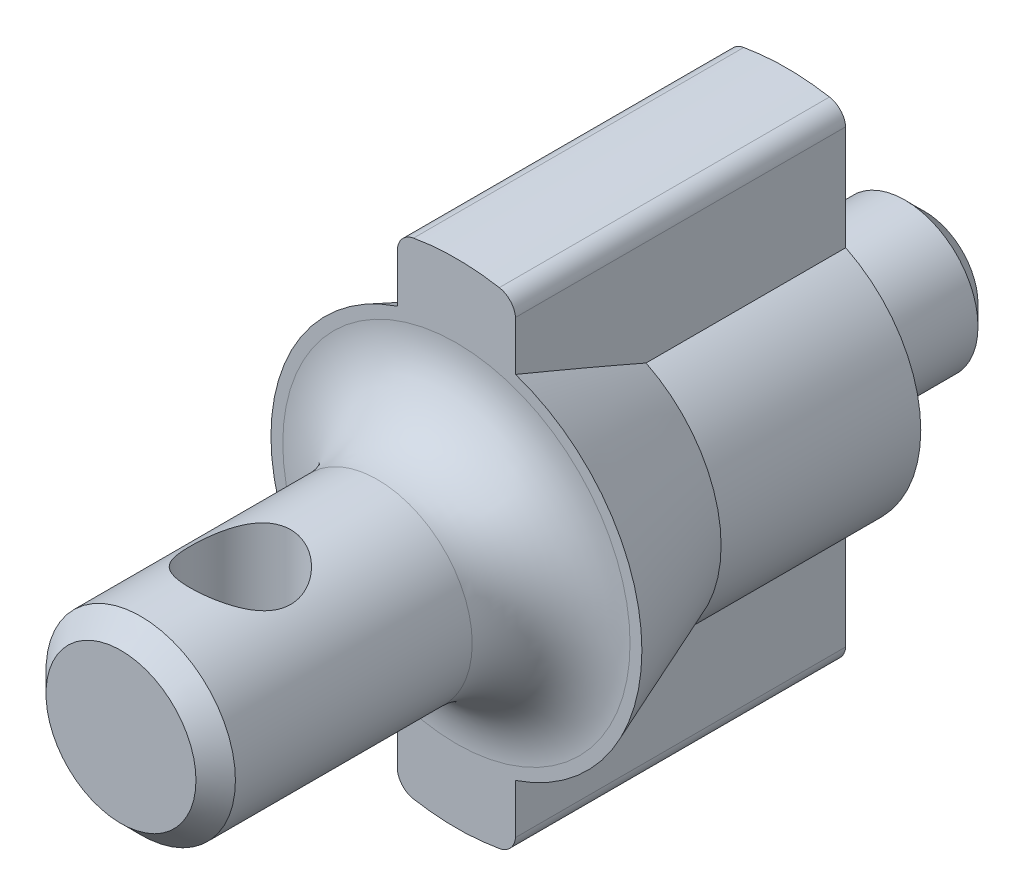
from build123d import *

# Parameters (mm, degrees)
SKETCH1_R               = 4.7
BOSS_EXTRUDE1_DEPTH     = 11.866666667
SKETCH2_OUTSIDE_W       = 14.964
SKETCH2_OUTSIDE_H       = 14.964
SKETCH2_OUTSIDE_R       = 1.85
CUT_EXTRUDE1_DEPTH      = 3.5
BOSS_EXTRUDE2_START     = -8.366666667
BOSS_EXTRUDE2_DEPTH     = 8.366666667
FILLET1_R               = 0.5
FILLET2_R               = 0.5
SKETCH4_R               = 2.4
BOSS_EXTRUDE3_DEPTH     = 8.5
FILLET3_R               = 2
CHAMFER1_SIZE           = 0.5
CUT_EXTRUDE2_DEPTH      = 22.816361088
CUT_EXTRUDE2_DEPTH_BACK = 22.816361088
SKETCH5_R               = 1.275
BOSS_EXTRUDE4_START     = 3.5
BOSS_EXTRUDE4_DEPTH     = 8.366666667


# Read off the part's stored shape, not the designer's step: Boss-Extrude4
with BuildPart() as part:
    # Sketch1 → Boss-Extrude1 (new body)
    with BuildSketch(Plane.XY):
        Circle(SKETCH1_R)
    extrude(amount=BOSS_EXTRUDE1_DEPTH)

    # Sketch2 outside → Cut-Extrude1 (cut)
    with BuildSketch(Plane(origin=(0, 0, 0), x_dir=(-1, 0, 0), z_dir=(0, 0, -1))):
        Rectangle(SKETCH2_OUTSIDE_W, SKETCH2_OUTSIDE_H)
        Circle(SKETCH2_OUTSIDE_R, mode=Mode.SUBTRACT)
    extrude(amount=-CUT_EXTRUDE1_DEPTH, mode=Mode.SUBTRACT)

    # Sketch3 → Boss-Extrude2 (add)
    with BuildSketch(Plane.XY.offset(11.866666667).offset(BOSS_EXTRUDE2_START)):
        with BuildLine():
            Line((-1.5, 6.06733055), (-1.5, 4.45421149))
            ThreePointArc((-1.5, 4.45421149), (0, 4.7), (1.5, 4.45421149))
            Line((1.5, 4.45421149), (1.5, 6.06733055))
            ThreePointArc((1.5, 6.06733055), (0, 6.25), (-1.5, 6.06733055))
        make_face()
        with BuildLine():
            ThreePointArc((1.5, -4.45421149), (0, -4.7), (-1.5, -4.45421149))
            Line((-1.5, -4.45421149), (-1.5, -6.06733055))
            ThreePointArc((-1.5, -6.06733055), (0, -6.25), (1.5, -6.06733055))
            Line((1.5, -6.06733055), (1.5, -4.45421149))
        make_face()
    extrude(amount=BOSS_EXTRUDE2_DEPTH)

    # Fillet1
    fillet1_edges = [part.edges().sort_by_distance(p)[0] for p in [
        (-1.5, 6.06733055, 7.683333333),
        (-1.5, 4.45421149, 7.683333333),
        (1.5, 4.45421149, 7.683333333),
        (1.5, 6.06733055, 7.683333333),
        (1.5, -6.06733055, 7.683333333),
        (1.5, -4.45421149, 7.683333333),
        (-1.5, -4.45421149, 7.683333333),
        (-1.5, -6.06733055, 7.683333333),
    ]]
    fillet(fillet1_edges, radius=FILLET1_R)

    # Fillet2
    fillet2_edges = [part.edges().sort_by_distance(p)[0] for p in [
        (1.85, 0, 3.5),
    ]]
    fillet(fillet2_edges, radius=FILLET2_R)

    # Sketch4 → Boss-Extrude3 (add)
    with BuildSketch(Plane.XY.offset(11.866666667)):
        Circle(SKETCH4_R)
    extrude(amount=BOSS_EXTRUDE3_DEPTH)

    # Fillet3
    fillet3_edges = [part.edges().sort_by_distance(p)[0] for p in [
        (-2.4, 0, 11.866666667),
    ]]
    fillet(fillet3_edges, radius=FILLET3_R)

    # Chamfer1
    chamfer1_edges = [part.edges().sort_by_distance(p)[0] for p in [
        (-2.4, 0, 20.366666667),
        (1.85, 0, 0),
    ]]
    chamfer(chamfer1_edges, length=CHAMFER1_SIZE)

    # Sketch5 → Cut-Extrude2 (cut, two sides: drawn at the far end of the back side and taken through both)
    with BuildSketch(Plane(origin=(0, 0, 0), x_dir=(1, 0, 0), z_dir=(0, 1, 0)).offset(-CUT_EXTRUDE2_DEPTH_BACK)):
        with Locations(Location((0, -17.341666667, 0), (0, 0, 270))):
            Circle(SKETCH5_R)
    extrude(amount=CUT_EXTRUDE2_DEPTH + CUT_EXTRUDE2_DEPTH_BACK, mode=Mode.SUBTRACT)

    # Sketch6 → Cut-Revolve1 (revolve, cut)
    with BuildSketch(Plane(origin=(0, 0, 0), x_dir=(1, 0, 0), z_dir=(0, 1, 0)), mode=Mode.PRIVATE) as cut_revolve1_sk:
        Polygon((-4.7, -3.5), (-5.9, -3.5), (-5.9, -11.866666667), (-4.7, -11.866666667), (-3.4, -8.55965578), (-3.4, -3.5), align=None)
    revolve(cut_revolve1_sk.sketch.rotate(Axis((0, 0, 0), (0, 0, 1)), 180), axis=Axis((0, 0, 0), (0, 0, 1)), mode=Mode.SUBTRACT)


with BuildPart() as cut_revolve1_piece_1:
    # of the separate pieces the step leaves, piece 1, a body of its own (cut_revolve1_pieces)
    add(part.part.solids().sort_by_distance((2.4, 0, 19.866666667))[0])



with BuildPart() as cut_revolve1_piece_2:
    # of the separate pieces the step leaves, piece 2, a body of its own (cut_revolve1_pieces)
    add(part.part.solids().sort_by_distance((1.498035668, 5.706653059, 11.866666667))[0])


with BuildPart() as cut_revolve1_piece_3:
    # of the separate pieces the step leaves, piece 3, a body of its own (cut_revolve1_pieces)
    add(part.part.solids().sort_by_distance((1.498035668, -5.706653059, 11.866666667))[0])


with BuildPart() as cut_revolve1_piece_1_1:
    add(cut_revolve1_piece_1.part)

    add(cut_revolve1_piece_2.part)  # Boss-Extrude4 merges Cut-Revolve1 piece 2

    add(cut_revolve1_piece_3.part)  # Boss-Extrude4 merges Cut-Revolve1 piece 3
    # Boss-Extrude4 outline → Boss-Extrude4 (add)
    with BuildSketch(Plane.XY.offset(BOSS_EXTRUDE4_START)):
        with BuildLine():
            ThreePointArc((-1.498035668, -5.706653059), (0, -5.9), (1.498035668, -5.706653059))
            Line((1.498035668, -5.706653059), (1.498035668, -3.052194151))
            ThreePointArc((1.498035668, -3.052194151), (0, -3.4), (-1.498035668, -3.052194151))
            Line((-1.498035668, -3.052194151), (-1.498035668, -5.706653059))
        make_face()
        with BuildLine():
            Line((-1.498035668, 5.706653059), (-1.498035668, 3.052194151))
            ThreePointArc((-1.498035668, 3.052194151), (0, 3.4), (1.498035668, 3.052194151))
            Line((1.498035668, 3.052194151), (1.498035668, 5.706653059))
            ThreePointArc((1.498035668, 5.706653059), (0, 5.9), (-1.498035668, 5.706653059))
        make_face()
    extrude(amount=BOSS_EXTRUDE4_DEPTH)


solid = cut_revolve1_piece_1_1.part
